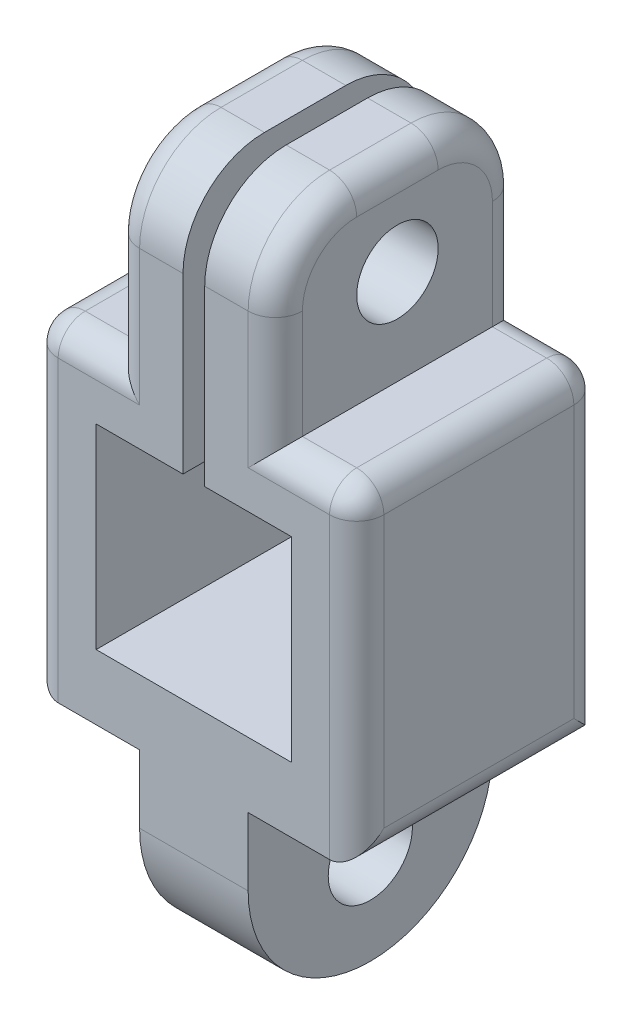
from build123d import *

# Parameters (mm, degrees)
SKETCH_1_W          = 3
SKETCH_1_H          = 7
SKETCH_1_W_2        = 12
SKETCH_1_H_2        = 12
SKETCH_1_W_3        = 7
SKETCH_1_W_4        = 5
EXTRUDE_1_DEPTH     = 9
CUT_EXTRUDE_1_DEPTH = 17.911534525
FILLET_2_R          = 3
SKETCH_4_R          = 1.5
CUT_EXTRUDE_3_DEPTH = 19.193405399
FILLET_3_R          = 1
FILLET_4_R          = 1
FILLET_5_R          = 1
SKETCH_5_W          = 5
SKETCH_5_H          = 7
CUT_EXTRUDE_4_DEPTH = 9
EXTRUDE_2_DEPTH     = 7
FILLET_6_R          = 4.5
SKETCH_7_R          = 1.55
CUT_EXTRUDE_5_DEPTH = 4
SKETCH_8_W          = 3.1
SKETCH_8_H          = 0.1
CUT_EXTRUDE_6_DEPTH = 17.911534525


# Some blends are built 0.0001 mm under size
with BuildPart() as part:
    # 草图1 → 凸台-拉伸1 (new body)
    # profile 1 of 4: a face of its own
    with BuildSketch(Plane.XY):
        with Locations((-1.5, 9.5)):
            Rectangle(SKETCH_1_W, SKETCH_1_H)
    # profile 2 of 4: a face of its own
    with BuildSketch(Plane.XY):
        with Locations((1.5, 9.5)):
            Rectangle(SKETCH_1_W, SKETCH_1_H)
    # profile 3 of 4: a face of its own
    with BuildSketch(Plane.XY):
        Rectangle(SKETCH_1_W_2, SKETCH_1_H_2)
        Rectangle(SKETCH_1_W_3, SKETCH_1_H, mode=Mode.SUBTRACT)
    # profile 4 of 4: a face of its own
    with BuildSketch(Plane.XY):
        with Locations((1, -9.5)):
            Rectangle(SKETCH_1_W_4, SKETCH_1_H)
    extrude(amount=EXTRUDE_1_DEPTH)

    # 草图2 → 切除-拉伸1 (cut, through all)
    with BuildSketch(Plane.XY.offset(9)):
        Polygon((0, 13), (0.4, 13), (0.4, 3.5), (0, 3.5), (-0.4, 3.5), (-0.4, 13), align=None)
    extrude(amount=-CUT_EXTRUDE_1_DEPTH, mode=Mode.SUBTRACT)

    # 圆角2
    fillet_2_edges = [part.edges().sort_by_distance(p)[0] for p in [
        (1.7, 13, 9),
        (1.7, 13, 0),
        (-1.7, 13, 0),
        (-1.7, 13, 9),
    ]]
    fillet(fillet_2_edges, radius=FILLET_2_R)

    # 草图4 → 切除-拉伸3 (cut, through all)
    with BuildSketch(Plane(origin=(3, 0, 0), x_dir=(0, 0, -1), z_dir=(1, 0, 0))):
        with Locations((-4.5, 9.5)):
            Circle(SKETCH_4_R)
    extrude(amount=-CUT_EXTRUDE_3_DEPTH, mode=Mode.SUBTRACT)

    # 圆角3
    fillet_3_edges = [part.edges().sort_by_distance(p)[0] for p in [
        (3, 8, 9),
        (6, 0, 0),
        (3, 8, 0),
        (4.5, 6, 0),
        (6, 6, 4.5),
        (6, -6, 4.5),
        (4.5, 6, 9),
        (6, 0, 9),
        (3, 13, 4.5),
        (3, 12.121320344, 8.121320344),
        (3, 12.121320344, 0.878679656),
    ]]
    fillet(fillet_3_edges, radius=FILLET_3_R)

    # 圆角4
    fillet_4_edges = [part.edges().sort_by_distance(p)[0] for p in [
        (-3, 8, 9),
        (-6, 0, 0),
        (-4.5, 6, 0),
        (-3, 8, 0),
        (-4.5, 6, 9),
        (-6, 0, 9),
        (-6, -6, 4.5),
        (-3, 13, 4.5),
        (-3, 12.121320344, 8.121320344),
        (-3, 12.121320344, 0.878679656),
    ]]
    fillet(fillet_4_edges, radius=FILLET_4_R)

    # 圆角5
    # the kernel refuses this fillet: 1 mm, written as the material it takes off along each edge
    with BuildSketch(Plane(origin=(-5, 5, 8), x_dir=(0, 1, 0), z_dir=(-1, 0, 0))) as fillet_5_piece_1_section:
        Polygon((0, 0), (FILLET_5_R, 0), (FILLET_5_R, -FILLET_5_R), (0, -FILLET_5_R), align=None)
    fillet_5_piece_1 = extrude(amount=FILLET_5_R, mode=Mode.PRIVATE)
    fillet_5_piece_1 = fillet_5_piece_1 - Plane(origin=(-5, 5, 8), x_dir=(0, -0.7071067811865475, -0.7071067811865475), z_dir=(-1, 0, 0)) * Sphere(FILLET_5_R, mode=Mode.PRIVATE)
    add(fillet_5_piece_1, mode=Mode.SUBTRACT)
    with BuildSketch(Plane(origin=(-5, 5, 1), x_dir=(0, 1, 0), z_dir=(-1, 0, 0))) as fillet_5_piece_2_section:
        Polygon((0, 0), (FILLET_5_R, 0), (FILLET_5_R, FILLET_5_R), (0, FILLET_5_R), align=None)
    fillet_5_piece_2 = extrude(amount=FILLET_5_R, mode=Mode.PRIVATE)
    fillet_5_piece_2 = fillet_5_piece_2 - Plane(origin=(-5, 5, 1), x_dir=(0, -0.7071067811865475, 0.7071067811865475), z_dir=(-1, 0, 0)) * Sphere(FILLET_5_R, mode=Mode.PRIVATE)
    add(fillet_5_piece_2, mode=Mode.SUBTRACT)
    with BuildSketch(Plane(origin=(-6, 6, 1), x_dir=(0, -1, 0), z_dir=(0, 0, 1))) as fillet_5_piece_3:
        with BuildLine():
            CenterArc((FILLET_5_R, FILLET_5_R), FILLET_5_R, 180, 90)
            Line((0, FILLET_5_R), (0, 0))
            Line((0, 0), (FILLET_5_R, 0))
        make_face()
    extrude(amount=7, mode=Mode.SUBTRACT)

    # 草图5 → 切除-拉伸4 (cut)
    with BuildSketch(Plane.XY.offset(9)):
        with Locations((1, -9.5)):
            Rectangle(SKETCH_5_W, SKETCH_5_H)
    extrude(amount=-CUT_EXTRUDE_4_DEPTH, mode=Mode.SUBTRACT)

    # 草图6 → 凸台-拉伸2 (add)
    with BuildSketch(Plane.XZ.offset(6)):
        Polygon((0, 9), (-2, 9), (-2, 0), (0, 0), (2, 0), (2, 9), align=None)
    extrude(amount=EXTRUDE_2_DEPTH)

    # 圆角6
    fillet_6_edges = [part.edges().sort_by_distance(p)[0] for p in [
        (0, -13, 0),
        (0, -13, 9),
    ]]
    fillet(fillet_6_edges, radius=FILLET_6_R - 0.0001)  # a hair under: the kernel refuses the full size

    # 草图7 → 切除-拉伸5 (cut)
    with BuildSketch(Plane.ZY.offset(2)):
        with Locations((4.5, -9.5)):
            Circle(SKETCH_7_R)
    extrude(amount=-CUT_EXTRUDE_5_DEPTH, mode=Mode.SUBTRACT)

    # 草图8 → 切除-拉伸6 (cut, through all)
    with BuildSketch(Plane.XY.offset(9)):
        with Locations((-1.95, 3.55)):
            Rectangle(SKETCH_8_W, SKETCH_8_H)
        Polygon((0.4, 3.5), (3.5, 3.5), (3.6, 3.5), (3.6, 3.6), (0.4, 3.6), align=None)
        Polygon((3.6, 3.5), (3.5, 3.5), (3.5, -3.5), (3.5, -3.6), (3.6, -3.6), align=None)
        Polygon((-3.6, -3.5), (-3.5, -3.5), (-3.5, 3.5), (-3.5, 3.6), (-3.6, 3.6), align=None)
        Polygon((3.5, -3.6), (3.5, -3.5), (-3.5, -3.5), (-3.6, -3.5), (-3.6, -3.6), align=None)
    extrude(amount=-CUT_EXTRUDE_6_DEPTH, mode=Mode.SUBTRACT)


solid = part.part
